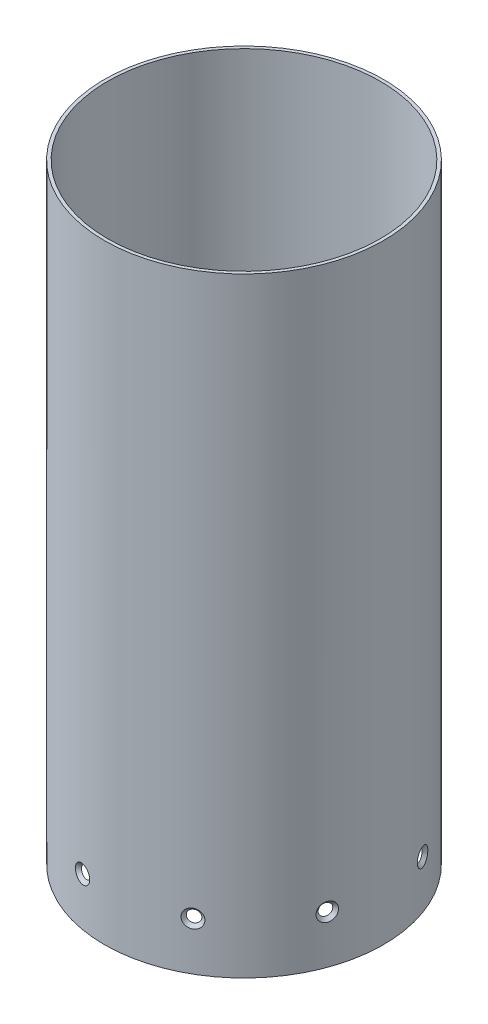
from build123d import *

# Parameters (mm, degrees)
SKETCH1_R           = 87
SKETCH1_R_2         = 85
BOSS_EXTRUDE1_DEPTH = 380
CUT_EXTRUDE1_REACH  = 428.902
SKETCH2_R           = 2.75
CIRPATTERN1_COUNT   = 9


with BuildPart() as part:
    # Sketch1 → Boss-Extrude1 (new body)
    with BuildSketch(Plane(origin=(0, 0, 0), x_dir=(1, 0, 0), z_dir=(0, 1, 0))):
        Circle(SKETCH1_R)
        Circle(SKETCH1_R_2, mode=Mode.SUBTRACT)
    extrude(amount=BOSS_EXTRUDE1_DEPTH)

    # Sketch2 → Cut-Extrude1 (cut, up to next)
    with BuildSketch(Plane.ZY.offset(87), mode=Mode.PRIVATE) as cut_extrude1_sk1:
        with Locations((0, 30)):
            Circle(SKETCH2_R)
    cut_extrude1_tool1 = extrude(cut_extrude1_sk1.sketch, amount=-CUT_EXTRUDE1_REACH, mode=Mode.PRIVATE) & part.part
    add(cut_extrude1_tool1.solids().sort_by_distance((-87, 30, 0))[0], mode=Mode.SUBTRACT)

    # Sketch4 → Cut-Revolve1 (revolve, cut)
    with BuildSketch(Plane.XZ.offset(-30)):
        Polygon((-86.355370418, -5), (-81.355370418, 0), (-86.355370418, 0), (-87.969003707, 0), (-87.969003707, -6.613633289), align=None)
    cut_revolve1 = revolve(axis=Axis((-93.993729437, 30, 0), (1, 0, 0)), mode=Mode.SUBTRACT)

    # CirPattern1: Cut-Revolve1 ×9 about axis
    cirpattern1_axis = Axis((0, 0, 0), (0, 1, 0))
    for i in range(1, CIRPATTERN1_COUNT):
        add(cut_revolve1.rotate(cirpattern1_axis, i * 360 / CIRPATTERN1_COUNT), mode=Mode.SUBTRACT)


solid = part.part
